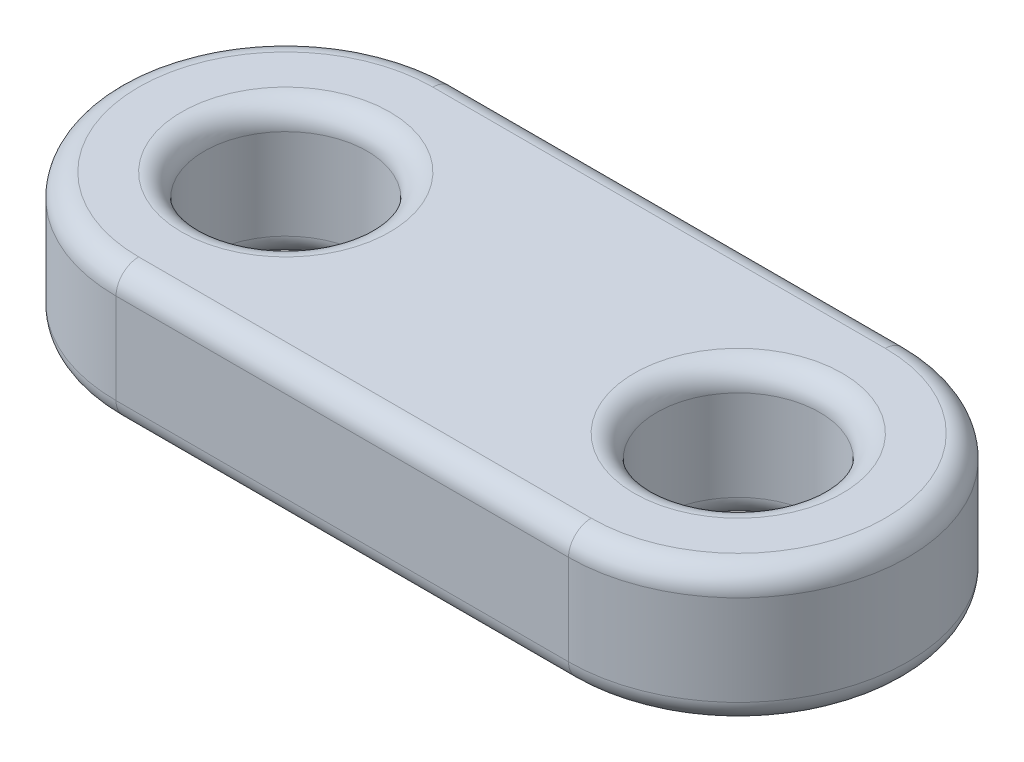
from build123d import *

# Parameters (mm, degrees)
BOSS_EXTRUDE1_DEPTH  = 3
M3_CLEARANCE_HOLE1_D = 3.6
FILLET1_R            = 0.5


with BuildPart() as part:
    # Sketch1 → Boss-Extrude1 (new body)
    with BuildSketch(Plane(origin=(0, 0, 0), x_dir=(1, 0, 0), z_dir=(0, 1, 0))):
        with BuildLine():
            Line((-5, 3.75), (5, 3.75))
            ThreePointArc((5, 3.75), (8.75, 0), (5, -3.75))
            Line((5, -3.75), (-5, -3.75))
            ThreePointArc((-5, -3.75), (-8.75, 0), (-5, 3.75))
        make_face()
    extrude(amount=BOSS_EXTRUDE1_DEPTH)

    # M3 Clearance Hole1 (through all)
    with Locations(Plane.XZ):
        with Locations((-5, 0), (5, 0)):
            Hole(M3_CLEARANCE_HOLE1_D / 2)

    # Fillet1
    fillet1_edges = [part.edges().sort_by_distance(p)[0] for p in [
        (0, 0, 3.75),
        (8.75, 0, 0),
        (0, 0, -3.75),
        (-8.75, 0, 0),
        (0, 3, -3.75),
        (8.75, 3, 0),
        (0, 3, 3.75),
        (-8.75, 3, 0),
        (6.8, 0, 0),
        (-3.2, 0, 0),
        (6.8, 3, 0),
        (-3.2, 3, 0),
    ]]
    fillet(fillet1_edges, radius=FILLET1_R)


solid = part.part
